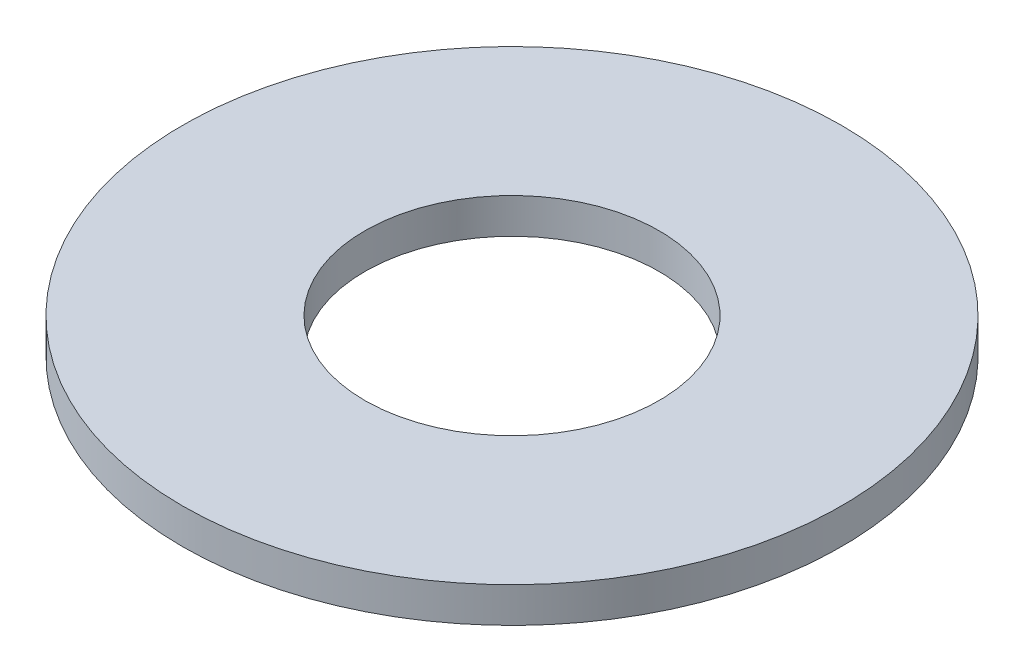
from build123d import *

# Parameters (mm, degrees)
SKETCH1_R          = 7.112
SKETCH1_R_2        = 3.175
EXTRUDE1_DEPTH     = 0.762
CUT_EXTRUDE1_START = -0.00127
CUT_EXTRUDE1_DEPTH = 0.00127


# Read off the part's stored shape, not the designer's step: Cut-Extrude1
with BuildPart() as part:
    # Sketch1 → Extrude1 (new body)
    with BuildSketch(Plane(origin=(0, 0, 0), x_dir=(1, 0, 0), z_dir=(0, 1, 0))):
        with Locations(Location((-25.280091638, -11.620687285, 0), (0, 0, 90))):
            Circle(SKETCH1_R)
        with Locations(Location((-25.280091638, -11.620687285, 0), (0, 0, 90))):
            Circle(SKETCH1_R_2, mode=Mode.SUBTRACT)
    extrude(amount=EXTRUDE1_DEPTH)

    # Cut-Extrude1 outline → Cut-Extrude1 (cut)
    with BuildSketch(Plane.XZ.offset(CUT_EXTRUDE1_START)):
        with BuildLine():
            add(Edge.make_bspline(
                [(-25.263766663, 14.822581091), (-25.263462636, 14.82257571), (-25.26286251, 14.822565089), (-25.261972257, 14.822489247), (-25.26110649, 14.822364653), (-25.260259958, 14.82221188), (-25.259441076, 14.821993401), (-25.25864076, 14.821743667), (-25.257865455, 14.821437937), (-25.257112611, 14.821094636), (-25.256388014, 14.820709607), (-25.255698927, 14.820282188), (-25.255036884, 14.819829348), (-25.254419194, 14.819326748), (-25.253825494, 14.818796977), (-25.253272376, 14.818224198), (-25.252748052, 14.817618723), (-25.252430121, 14.817189269), (-25.252270277, 14.816973356)],
                knots=[0, 0, 0, 0, 0.068588743, 0.135389008, 0.2013997, 0.265895894, 0.329317687, 0.392474627, 0.454948633, 0.517198434, 0.579075751, 0.639919915, 0.700070736, 0.75989445, 0.819446648, 0.879487749, 0.939410976, 1, 1, 1, 1], degree=3))
            add(Edge.make_bspline(
                [(-25.278035115, 14.808985779), (-25.278022204, 14.809458302), (-25.277996792, 14.810388301), (-25.277786234, 14.811750939), (-25.277465777, 14.813058901), (-25.277012739, 14.814307051), (-25.276438829, 14.815500328), (-25.275725048, 14.816626398), (-25.27489792, 14.817703046), (-25.273943689, 14.818701596), (-25.272906081, 14.819620575), (-25.271785546, 14.8204191), (-25.270604744, 14.821097803), (-25.269357536, 14.821643399), (-25.268049656, 14.82207162), (-25.266678642, 14.822369475), (-25.265243644, 14.822557398), (-25.264265494, 14.822573089), (-25.263766663, 14.822581091)],
                knots=[0, 0, 0, 0, 0.064384885, 0.126719757, 0.187531152, 0.247721204, 0.307399708, 0.367677885, 0.429150597, 0.492188794, 0.55567632, 0.617834117, 0.67943551, 0.741014297, 0.803090376, 0.86672986, 0.932035755, 1, 1, 1, 1], degree=3))
            add(Edge.make_bspline(
                [(-25.274738318, 14.799598919), (-25.275004671, 14.799926141), (-25.275533561, 14.800575899), (-25.276206252, 14.801633492), (-25.276773143, 14.802738824), (-25.277244936, 14.803889978), (-25.277605547, 14.805093703), (-25.277858311, 14.806348065), (-25.278009637, 14.807651652), (-25.278026537, 14.808536614), (-25.278035115, 14.808985779)],
                knots=[0, 0, 0, 0, 0.124385464, 0.246989123, 0.368903968, 0.49046959, 0.613479167, 0.739002749, 0.867530011, 1, 1, 1, 1], degree=3))
            add(Edge.make_bspline(
                [(-25.268811583, 14.795667247), (-25.268993282, 14.795725161), (-25.26940734, 14.795866568), (-25.27004497, 14.796113235), (-25.270711197, 14.796428988), (-25.271357846, 14.796772097), (-25.271983037, 14.797149318), (-25.272578962, 14.79756865), (-25.27315689, 14.798022149), (-25.273707767, 14.798511905), (-25.274240298, 14.799035942), (-25.274570864, 14.799409623), (-25.274738318, 14.799598919)],
                knots=[0.410131578, 0.410131578, 0.410131578, 0.410131578, 0.456956308, 0.517538168, 0.577895938, 0.637865812, 0.697237999, 0.757052326, 0.816675988, 0.877525975, 0.937958534, 1, 1, 1, 1], degree=3))
            ThreePointArc((-25.268811583, 14.795667247), (-25.263919463, 14.795646097), (-25.259027382, 14.79561741))
            add(Edge.make_bspline(
                [(-25.252360382, 14.80012365), (-25.252527745, 14.799920308), (-25.252861927, 14.799514284), (-25.253401571, 14.798941944), (-25.253977982, 14.798412549), (-25.254577908, 14.797911663), (-25.255208633, 14.797444562), (-25.255872576, 14.797014646), (-25.256567137, 14.796623091), (-25.257289383, 14.796268219), (-25.258034268, 14.795948111), (-25.258620273, 14.795745224), (-25.258953288, 14.795640193), (-25.259027382, 14.79561741)],
                knots=[0, 0, 0, 0, 0.060386511, 0.120576961, 0.180213911, 0.239769598, 0.299737345, 0.360088503, 0.421049988, 0.482478268, 0.544565801, 0.606844739, 0.624617313, 0.624617313, 0.624617313, 0.624617313], degree=3))
            Line((-25.252360382, 14.80012365), (-25.254427506, 14.801708445))
            add(Edge.make_bspline(
                [(-25.263692459, 14.797425789), (-25.263241219, 14.797435137), (-25.262351926, 14.79745356), (-25.261046516, 14.797655002), (-25.259797673, 14.797990944), (-25.258602326, 14.798457617), (-25.257467023, 14.799069349), (-25.256385546, 14.799810205), (-25.255358873, 14.800689447), (-25.254742204, 14.801364137), (-25.254427506, 14.801708445)],
                knots=[0, 0, 0, 0, 0.12822018, 0.252693269, 0.374430668, 0.495330801, 0.616694484, 0.740288613, 0.867464347, 1, 1, 1, 1], degree=3))
            add(Edge.make_bspline(
                [(-25.27526305, 14.808736664), (-25.275254636, 14.80834395), (-25.275238088, 14.807571512), (-25.275085079, 14.806437482), (-25.274838283, 14.805349901), (-25.27448255, 14.804311439), (-25.274016931, 14.8033253), (-25.273451666, 14.802388131), (-25.272786792, 14.801497804), (-25.272019477, 14.800672254), (-25.271177773, 14.799915831), (-25.270268354, 14.799257693), (-25.269306308, 14.798696526), (-25.268290776, 14.798230637), (-25.26721492, 14.797880333), (-25.266089886, 14.797615927), (-25.264908609, 14.797463226), (-25.264102774, 14.79743842), (-25.263692459, 14.797425789)],
                knots=[0, 0, 0, 0, 0.065071715, 0.127990836, 0.189302577, 0.249690302, 0.309564492, 0.369737351, 0.430831157, 0.493422923, 0.556271115, 0.618134384, 0.67916568, 0.740634608, 0.802964766, 0.8664059, 0.931976609, 1, 1, 1, 1], degree=3))
            add(Edge.make_bspline(
                [(-25.263740162, 14.819983936), (-25.263999962, 14.819979591), (-25.26451681, 14.819970948), (-25.265284272, 14.819909998), (-25.266035343, 14.819788339), (-25.26677543, 14.819633532), (-25.267499296, 14.819417419), (-25.268213831, 14.81916646), (-25.268906576, 14.818854686), (-25.269584991, 14.818508507), (-25.270231398, 14.818115538), (-25.270851468, 14.817698334), (-25.271428291, 14.817240293), (-25.271972805, 14.816752575), (-25.272473513, 14.816226375), (-25.272944948, 14.815673748), (-25.273372914, 14.815083912), (-25.273765221, 14.814464876), (-25.274114308, 14.813820263), (-25.274416413, 14.813153562), (-25.274680573, 14.81247063), (-25.274881555, 14.811760762), (-25.275057669, 14.81103571), (-25.275168605, 14.810285135), (-25.275247499, 14.809517476), (-25.275257838, 14.808998355), (-25.27526305, 14.808736664)],
                knots=[0, 0, 0, 0, 0.043391487, 0.086323045, 0.128431439, 0.170390697, 0.212503226, 0.254502927, 0.296776413, 0.33927073, 0.381626519, 0.423038549, 0.464006685, 0.50453788, 0.545023939, 0.585222959, 0.625769188, 0.666618137, 0.707546937, 0.748084576, 0.788802231, 0.829699109, 0.871211934, 0.913320328, 0.956304583, 1, 1, 1, 1], degree=3))
            add(Edge.make_bspline(
                [(-25.254358601, 14.815393862), (-25.254500872, 14.815578019), (-25.254783145, 14.815943398), (-25.255248717, 14.816448537), (-25.255725557, 14.816930509), (-25.256228471, 14.817374878), (-25.256755711, 14.817783389), (-25.257300813, 14.818161325), (-25.257870515, 14.818500644), (-25.258458902, 14.818806422), (-25.259062719, 14.819086719), (-25.259689184, 14.81931521), (-25.260327233, 14.819518002), (-25.260978831, 14.819690754), (-25.26164929, 14.819814251), (-25.262331611, 14.819911019), (-25.263030628, 14.819970989), (-25.263501531, 14.819979582), (-25.263740162, 14.819983936)],
                knots=[0, 0, 0, 0, 0.064379548, 0.127733211, 0.189973065, 0.251983901, 0.313314248, 0.374488438, 0.435457065, 0.496699623, 0.557971458, 0.619554714, 0.681106899, 0.743256401, 0.805978475, 0.86967093, 0.933955694, 1, 1, 1, 1], degree=3))
            Line((-25.254358601, 14.815393862), (-25.252270277, 14.816973356))
        make_face()
        with BuildLine():
            add(Edge.make_bspline(
                [(-25.245075561, 14.795494189), (-25.245139119, 14.795521831), (-25.245374507, 14.795627955), (-25.245775357, 14.795835346), (-25.246270526, 14.796138596), (-25.246754891, 14.796488447), (-25.247224274, 14.79689681), (-25.247682436, 14.797357571), (-25.248135913, 14.797870427), (-25.248580391, 14.798435372), (-25.249007721, 14.799060517), (-25.249434148, 14.799732005), (-25.249698514, 14.800207251), (-25.24983394, 14.800450706)],
                knots=[0.31660352, 0.31660352, 0.31660352, 0.31660352, 0.336890953, 0.39218063, 0.448600738, 0.506746616, 0.566889643, 0.630529793, 0.696852318, 0.767214853, 0.840820215, 0.918457063, 1, 1, 1, 1], degree=3))
            ThreePointArc((-25.245075561, 14.795494189), (-25.241981631, 14.795458557), (-25.238887737, 14.79541991))
            add(Edge.make_bspline(
                [(-25.23442592, 14.801887091), (-25.234433208, 14.801651705), (-25.234447586, 14.801187351), (-25.234557248, 14.800503257), (-25.234732888, 14.799845064), (-25.234971416, 14.799206922), (-25.23528703, 14.798597893), (-25.235667116, 14.79801211), (-25.236107512, 14.797445216), (-25.236620467, 14.796918103), (-25.237173814, 14.796428042), (-25.237767243, 14.79600087), (-25.238339534, 14.79566661), (-25.238720912, 14.795489829), (-25.238887737, 14.79541991)],
                knots=[0, 0, 0, 0, 0.061802331, 0.121919742, 0.181463111, 0.240499842, 0.300477399, 0.361230802, 0.423703684, 0.488685423, 0.55412121, 0.617612924, 0.680408967, 0.727893439, 0.727893439, 0.727893439, 0.727893439], degree=3))
            add(Edge.make_bspline(
                [(-25.240335773, 14.810362297), (-25.240062475, 14.810155379), (-25.239531774, 14.809753575), (-25.238781295, 14.809144644), (-25.238094673, 14.808557131), (-25.237478364, 14.807985117), (-25.236930809, 14.807427292), (-25.236448156, 14.806889054), (-25.236031073, 14.806367744), (-25.235571379, 14.805707842), (-25.235115359, 14.804886906), (-25.234714619, 14.803891259), (-25.234467907, 14.802890291), (-25.234439803, 14.802218789), (-25.23442592, 14.801887091)],
                knots=[0, 0, 0, 0, 0.095859516, 0.186143795, 0.27022999, 0.348540534, 0.421214496, 0.488753862, 0.550640118, 0.607795182, 0.713518804, 0.812426694, 0.907345667, 1, 1, 1, 1], degree=3))
            add(Edge.make_bspline(
                [(-25.243722675, 14.813012456), (-25.243668573, 14.812960462), (-25.243538425, 14.812835388), (-25.243291133, 14.812640101), (-25.242979163, 14.812382743), (-25.242592868, 14.812076122), (-25.24213027, 14.811723424), (-25.241599554, 14.811311569), (-25.240992086, 14.810854105), (-25.24056199, 14.810531813), (-25.240335773, 14.810362297)],
                knots=[0, 0, 0, 0, 0.052302027, 0.125815361, 0.219526843, 0.334401959, 0.469696029, 0.625197814, 0.802866194, 1, 1, 1, 1], degree=3))
            add(Edge.make_bspline(
                [(-25.245365774, 14.81643116), (-25.245361735, 14.816289574), (-25.245353668, 14.816006745), (-25.245287039, 14.815585971), (-25.245181744, 14.815169671), (-25.245026198, 14.814756016), (-25.2448082, 14.814336231), (-25.244510507, 14.813910592), (-25.244151427, 14.813457151), (-25.243870268, 14.813165536), (-25.243722675, 14.813012456)],
                knots=[0, 0, 0, 0, 0.108739323, 0.217215631, 0.326529672, 0.438228542, 0.556022522, 0.688937266, 0.836710336, 1, 1, 1, 1], degree=3))
            add(Edge.make_bspline(
                [(-25.241735057, 14.819765059), (-25.241990715, 14.819755391), (-25.242484247, 14.819736727), (-25.243185482, 14.819549811), (-25.243818407, 14.81925047), (-25.244357951, 14.818823563), (-25.244807513, 14.818320316), (-25.245126114, 14.81773968), (-25.245333367, 14.817105835), (-25.245354833, 14.816658943), (-25.245365774, 14.81643116)],
                knots=[0, 0, 0, 0, 0.138982241, 0.268295829, 0.392256169, 0.517764565, 0.64052371, 0.757269986, 0.876278966, 1, 1, 1, 1], degree=3))
            add(Edge.make_bspline(
                [(-25.23693827, 14.816515965), (-25.237057323, 14.816674054), (-25.237287435, 14.816979619), (-25.237637663, 14.817407569), (-25.237972915, 14.817796843), (-25.238291976, 14.818146124), (-25.238603326, 14.818448237), (-25.238890818, 14.818717199), (-25.239175335, 14.818935285), (-25.239531205, 14.819173802), (-25.239982051, 14.819410021), (-25.240545032, 14.819614039), (-25.241132348, 14.81974002), (-25.241533033, 14.819756666), (-25.241735057, 14.819765059)],
                knots=[0, 0, 0, 0, 0.098325002, 0.190048433, 0.274697739, 0.353593501, 0.424981941, 0.490234083, 0.549057711, 0.602866006, 0.702996713, 0.801023427, 0.899677067, 1, 1, 1, 1], degree=3))
            Line((-25.23693827, 14.816515965), (-25.234786342, 14.818132561))
            add(Edge.make_bspline(
                [(-25.241671453, 14.822484121), (-25.241365022, 14.822470812), (-25.24075779, 14.822444437), (-25.239863086, 14.822265898), (-25.239004348, 14.821964429), (-25.238315868, 14.821621441), (-25.237772503, 14.82128625), (-25.237362915, 14.820977131), (-25.236944967, 14.820623583), (-25.236523127, 14.820220791), (-25.236094076, 14.819769129), (-25.235657991, 14.819269539), (-25.23522092, 14.818718868), (-25.234933635, 14.818331281), (-25.234786342, 14.818132561)],
                knots=[0, 0, 0, 0, 0.108192092, 0.214396207, 0.32074499, 0.42872281, 0.485331903, 0.545974401, 0.609721054, 0.678564002, 0.751817147, 0.829640858, 0.912655578, 1, 1, 1, 1], degree=3))
            add(Edge.make_bspline(
                [(-25.248090136, 14.816341055), (-25.248078212, 14.816621009), (-25.248054697, 14.817173084), (-25.24788944, 14.817980075), (-25.24763176, 14.818750649), (-25.24726127, 14.81947139), (-25.246807905, 14.82014102), (-25.246263058, 14.820740585), (-25.245629804, 14.821257024), (-25.244925337, 14.821694884), (-25.244165906, 14.822049128), (-25.243363542, 14.82230677), (-25.242527018, 14.82245796), (-25.241958275, 14.822475351), (-25.241671453, 14.822484121)],
                knots=[0, 0, 0, 0, 0.084762166, 0.167152893, 0.248557413, 0.330172762, 0.411814426, 0.492885778, 0.574634371, 0.658535589, 0.743533956, 0.827820037, 0.913168124, 1, 1, 1, 1], degree=3))
            add(Edge.make_bspline(
                [(-25.246717354, 14.812312814), (-25.246827699, 14.81246839), (-25.24704574, 14.812775809), (-25.247323929, 14.813259802), (-25.247567497, 14.813747896), (-25.247755525, 14.814250483), (-25.247913178, 14.814758821), (-25.248018364, 14.815279082), (-25.248076565, 14.815807903), (-25.24808559, 14.816162472), (-25.248090136, 14.816341055)],
                knots=[0, 0, 0, 0, 0.132021969, 0.26087605, 0.386190009, 0.509352935, 0.63205917, 0.75444165, 0.87632153, 1, 1, 1, 1], degree=3))
            add(Edge.make_bspline(
                [(-25.242636111, 14.808692698), (-25.242896283, 14.808893517), (-25.243394318, 14.809277935), (-25.244099701, 14.809837271), (-25.24472365, 14.81035902), (-25.245279155, 14.81082756), (-25.245749375, 14.81126115), (-25.246141501, 14.811650003), (-25.246468151, 14.811984777), (-25.246639672, 14.812210558), (-25.246717354, 14.812312814)],
                knots=[0, 0, 0, 0, 0.180311552, 0.345162257, 0.493840229, 0.626519829, 0.743820045, 0.844575023, 0.929607857, 1, 1, 1, 1], degree=3))
            add(Edge.make_bspline(
                [(-25.238146742, 14.804447144), (-25.238258109, 14.804598653), (-25.238492771, 14.804917898), (-25.23889637, 14.805390642), (-25.239361593, 14.805887526), (-25.239893347, 14.806404127), (-25.240483995, 14.806950476), (-25.241146259, 14.807510595), (-25.241864901, 14.808100243), (-25.242373492, 14.808490951), (-25.242636111, 14.808692698)],
                knots=[0, 0, 0, 0, 0.09095364, 0.191649088, 0.300511095, 0.420198938, 0.550270192, 0.689719527, 0.839782266, 1, 1, 1, 1], degree=3))
            add(Edge.make_bspline(
                [(-25.23727219, 14.801849989), (-25.237282628, 14.802069991), (-25.237303688, 14.802513892), (-25.237470833, 14.803175108), (-25.237748923, 14.803829365), (-25.238011359, 14.804236906), (-25.238146742, 14.804447144)],
                knots=[0, 0, 0, 0, 0.23698289, 0.478162642, 0.730799004, 1, 1, 1, 1], degree=3))
            add(Edge.make_bspline(
                [(-25.242159082, 14.797403024), (-25.241941351, 14.797410258), (-25.24150832, 14.797424646), (-25.24086972, 14.797536975), (-25.240254074, 14.797732876), (-25.239663819, 14.797992313), (-25.23912279, 14.798327547), (-25.238631702, 14.798706552), (-25.238222104, 14.799152847), (-25.237882123, 14.79964264), (-25.237611649, 14.800164544), (-25.237419542, 14.800712431), (-25.237298933, 14.801275881), (-25.237281105, 14.801658598), (-25.23727219, 14.801849989)],
                knots=[0, 0, 0, 0, 0.088866925, 0.176741747, 0.263664033, 0.352137805, 0.439230524, 0.522932567, 0.604598891, 0.685439151, 0.765769331, 0.843792899, 0.921883126, 1, 1, 1, 1], degree=3))
            add(Edge.make_bspline(
                [(-25.247591906, 14.801775785), (-25.247398017, 14.801431274), (-25.247027352, 14.80077266), (-25.246405076, 14.799883262), (-25.245763, 14.799125888), (-25.245092306, 14.798503595), (-25.244397723, 14.798013047), (-25.243673896, 14.797667113), (-25.242926065, 14.797448659), (-25.242414927, 14.797418246), (-25.242159082, 14.797403024)],
                knots=[0, 0, 0, 0, 0.161866968, 0.309446751, 0.443922213, 0.567877743, 0.683321565, 0.790799438, 0.895287041, 1, 1, 1, 1], degree=3))
            Line((-25.247591906, 14.801775785), (-25.24983394, 14.800450706))
        make_face()
    extrude(amount=CUT_EXTRUDE1_DEPTH, mode=Mode.SUBTRACT)


solid = part.part
